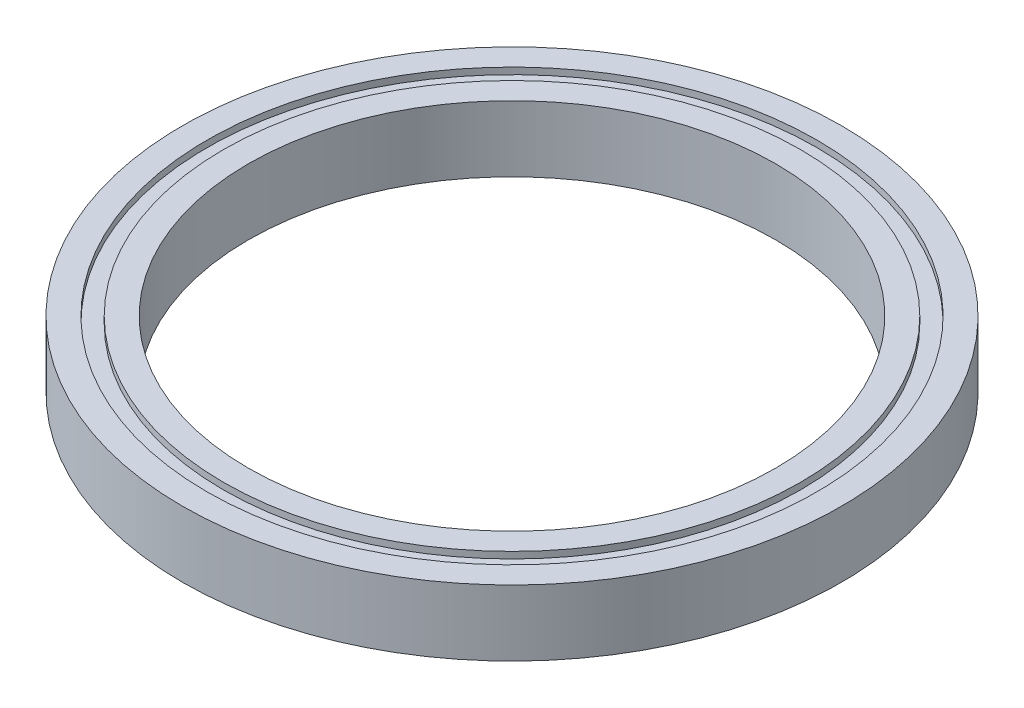
from build123d import *

# Parameters (mm, degrees)
SKETCH1_R           = 50
SKETCH1_R_2         = 40
BOSS_EXTRUDE1_DEPTH = 10
SKETCH2_R           = 46.25
SKETCH2_R_2         = 43.75
CUT_EXTRUDE1_DEPTH  = 1
CUT_EXTRUDE2_START  = -1
SKETCH3_R           = 46.25
SKETCH3_R_2         = 43.75
CUT_EXTRUDE2_DEPTH  = 1


with BuildPart() as part:
    # Sketch1 → Boss-Extrude1 (new body)
    with BuildSketch(Plane(origin=(0, 0, 0), x_dir=(1, 0, 0), z_dir=(0, 1, 0))):
        Circle(SKETCH1_R)
        Circle(SKETCH1_R_2, mode=Mode.SUBTRACT)
    extrude(amount=BOSS_EXTRUDE1_DEPTH)

    # Sketch2 → Cut-Extrude1 (cut)
    with BuildSketch(Plane(origin=(0, 10, 0), x_dir=(1, 0, 0), z_dir=(0, 1, 0))):
        Circle(SKETCH2_R)
        Circle(SKETCH2_R_2, mode=Mode.SUBTRACT)
    extrude(amount=-CUT_EXTRUDE1_DEPTH, mode=Mode.SUBTRACT)

    # Sketch3 → Cut-Extrude2 (cut)
    with BuildSketch(Plane.XZ.offset(CUT_EXTRUDE2_START)):
        Circle(SKETCH3_R)
        Circle(SKETCH3_R_2, mode=Mode.SUBTRACT)
    extrude(amount=CUT_EXTRUDE2_DEPTH, mode=Mode.SUBTRACT)


solid = part.part
